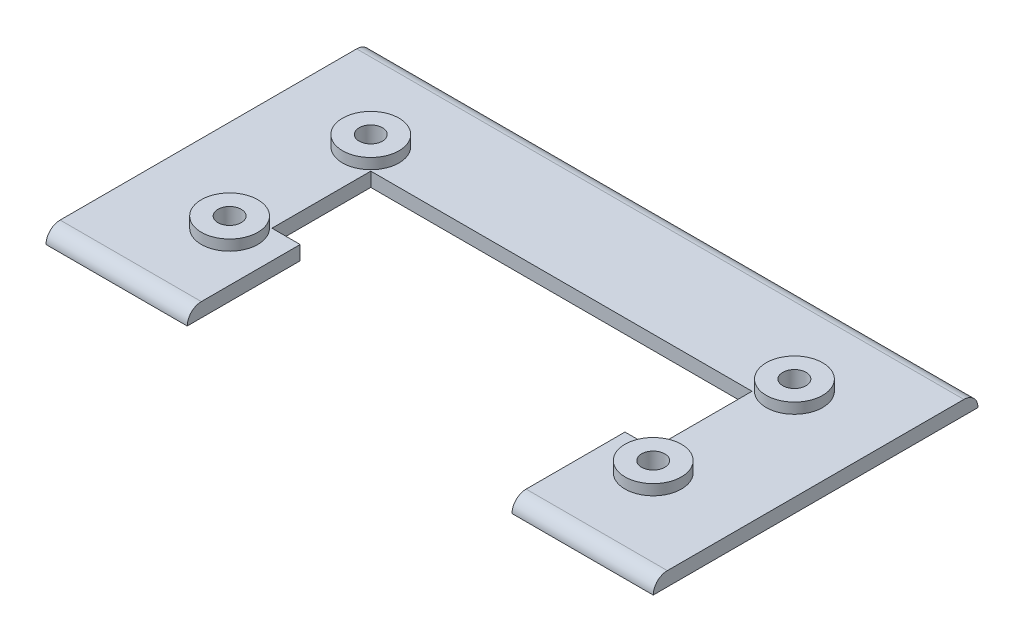
from build123d import *

# Parameters (mm, degrees)
SKETCH1_W               = 86
SKETCH1_H               = 46
BOSS_EXTRUDE1_DEPTH     = 2
SKETCH2_W               = 54
SKETCH2_H               = 14
CUT_EXTRUDE1_DEPTH      = 49.805737368
SKETCH4_R               = 4
BOSS_EXTRUDE2_DEPTH     = 1.5
CUT_EXTRUDE2_DEPTH      = 1.5
CUT_EXTRUDE2_DEPTH_BACK = 10
SKETCH3_R               = 1.65
SKETCH5_W               = 74
SKETCH5_H               = 34
SKETCH5_W_2             = 70
SKETCH5_H_2             = 30
CUT_EXTRUDE3_DEPTH      = 10
CUT_EXTRUDE3_TAPER      = 45
FILLET1_R               = 2
FILLET2_R               = 2
SKETCH6_W               = 46
SKETCH6_H               = 16
CUT_EXTRUDE4_DEPTH      = 10
BOSS_EXTRUDE3_START     = -1
SKETCH8_W               = 1.5
SKETCH8_H               = 2
BOSS_EXTRUDE3_DEPTH     = 1


with BuildPart() as part:
    # Sketch1 → Boss-Extrude1 (new body)
    with BuildSketch(Plane(origin=(0, 0, 0), x_dir=(1, 0, 0), z_dir=(0, 1, 0))):
        Rectangle(SKETCH1_W, SKETCH1_H)
    extrude(amount=BOSS_EXTRUDE1_DEPTH)

    # Sketch2 → Cut-Extrude1 (cut, through all)
    with BuildSketch(Plane(origin=(0, 2, 0), x_dir=(1, 0, 0), z_dir=(0, 1, 0))):
        Rectangle(SKETCH2_W, SKETCH2_H)
    extrude(amount=-CUT_EXTRUDE1_DEPTH, mode=Mode.SUBTRACT)

    # Sketch4 → Boss-Extrude2 (add)
    with BuildSketch(Plane(origin=(0, 2, 0), x_dir=(1, 0, 0), z_dir=(0, 1, 0))):
        with Locations(Location((-30, 10, 0), (0, 0, 270))):
            Circle(SKETCH4_R)
        with Locations(Location((-30, -10, 0), (0, 0, 90))):
            Circle(SKETCH4_R)
        with Locations(Location((30, -10, 0), (0, 0, 270))):
            Circle(SKETCH4_R)
        with Locations(Location((30, 10, 0), (0, 0, 90))):
            Circle(SKETCH4_R)
    extrude(amount=BOSS_EXTRUDE2_DEPTH)

    # Sketch3 → Cut-Extrude2 (cut, two sides: drawn at the far end of the back side and taken through both)
    with BuildSketch(Plane(origin=(0, 2, 0), x_dir=(1, 0, 0), z_dir=(0, 1, 0)).offset(-CUT_EXTRUDE2_DEPTH_BACK)):
        with Locations(Location((-30, 10, 0), (0, 0, 270))):
            Circle(SKETCH3_R)
        with Locations(Location((30, 10, 0), (0, 0, 270))):
            Circle(SKETCH3_R)
        with Locations(Location((30, -10, 0), (0, 0, 270))):
            Circle(SKETCH3_R)
        with Locations(Location((-30, -10, 0), (0, 0, 270))):
            Circle(SKETCH3_R)
    extrude(amount=CUT_EXTRUDE2_DEPTH + CUT_EXTRUDE2_DEPTH_BACK, mode=Mode.SUBTRACT)

    # Sketch5 → Cut-Extrude3 (cut)
    with BuildSketch(Plane.XZ):
        Rectangle(SKETCH5_W, SKETCH5_H)
        Rectangle(SKETCH5_W_2, SKETCH5_H_2, mode=Mode.SUBTRACT)
    extrude(amount=-CUT_EXTRUDE3_DEPTH, taper=CUT_EXTRUDE3_TAPER, mode=Mode.SUBTRACT)

    # Fillet1
    fillet1_edges = [part.edges().sort_by_distance(p)[0] for p in [
        (0, 2, -23),
    ]]
    fillet(fillet1_edges, radius=FILLET1_R - 0.0001)  # a hair under: the kernel refuses the full size

    # Fillet2
    fillet2_edges = [part.edges().sort_by_distance(p)[0] for p in [
        (0, 2, 23),
    ]]
    fillet(fillet2_edges, radius=FILLET2_R - 0.0001)  # a hair under: the kernel refuses the full size

    # Sketch6 → Cut-Extrude4 (cut)
    with BuildSketch(Plane(origin=(0, 2, 0), x_dir=(1, 0, 0), z_dir=(0, 1, 0))):
        with Locations((0, -15)):
            Rectangle(SKETCH6_W, SKETCH6_H)
    extrude(amount=-CUT_EXTRUDE4_DEPTH, mode=Mode.SUBTRACT)

    # Sketch8 → Boss-Extrude3 (add)
    with BuildSketch(Plane.XZ.offset(BOSS_EXTRUDE3_START)):
        with Locations((23.75, 16)):
            Rectangle(SKETCH8_W, SKETCH8_H)
        with Locations((-23.75, 16)):
            Rectangle(SKETCH8_W, SKETCH8_H)
    extrude(amount=BOSS_EXTRUDE3_DEPTH)


solid = part.part
